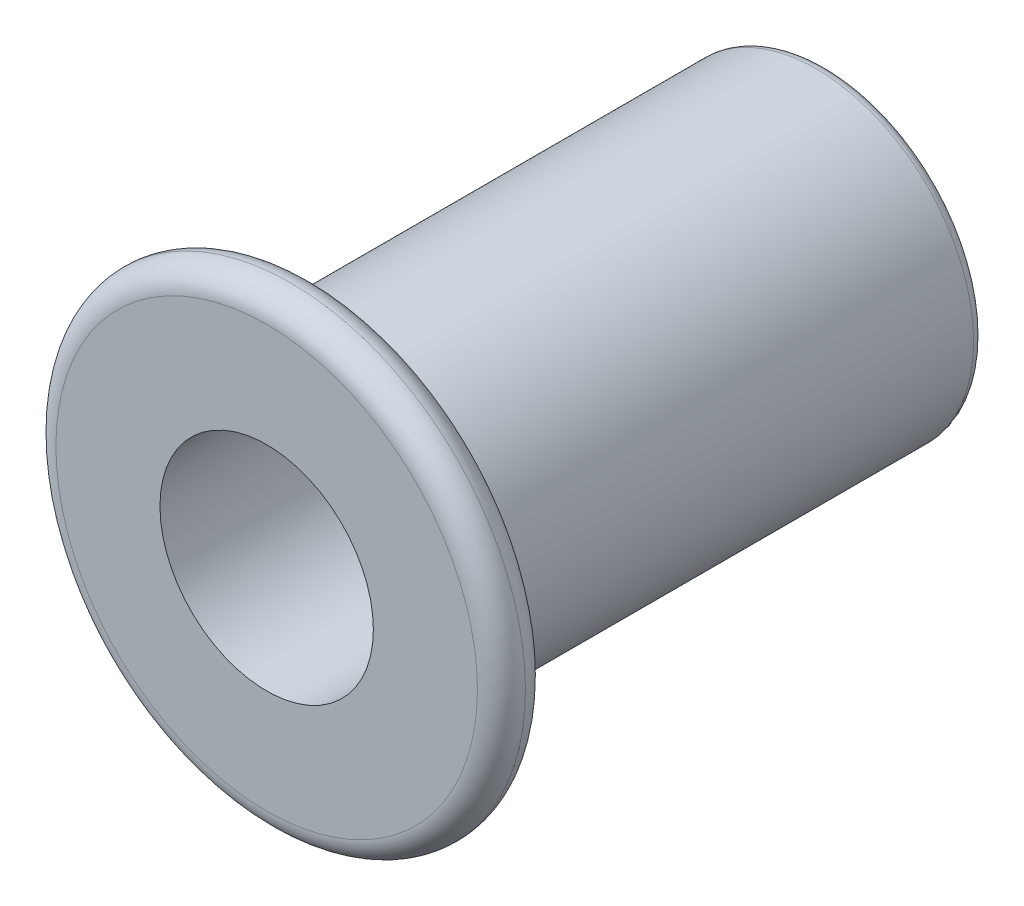
from build123d import *

# Parameters (mm, degrees)
SKETCH_1_R      = 2.95
SKETCH_1_R_2    = 2
EXTRUDE_1_DEPTH = 9.6
EXTRUDE_START   = 0.9
SKETCH_2_R      = 4.4
SKETCH_2_R_2    = 2
EXTRUDE_2_DEPTH = 0.9
FILLET_1_R      = 0.45
FILLET_2_R      = 0.2


with BuildPart() as part:
    # 草图1 → 凸台-拉伸1 (new body)
    with BuildSketch(Plane.XY):
        Circle(SKETCH_1_R)
        Circle(SKETCH_1_R_2, mode=Mode.SUBTRACT)
    extrude(amount=-EXTRUDE_1_DEPTH)

    # 草图2 → 凸台-拉伸2 (add)
    with BuildSketch(Plane.XY.offset(EXTRUDE_START)):
        Circle(SKETCH_2_R)
        Circle(SKETCH_2_R_2, mode=Mode.SUBTRACT)
    extrude(amount=-EXTRUDE_2_DEPTH)

    # 圆角1
    fillet_1_edges = [part.edges().sort_by_distance(p)[0] for p in [
        (-4.4, 0, 0),
        (-4.4, 0, 0.9),
    ]]
    fillet(fillet_1_edges, radius=FILLET_1_R - 0.0001)  # a hair under: the kernel refuses the full size

    # 圆角2
    fillet_2_edges = [part.edges().sort_by_distance(p)[0] for p in [
        (-2.95, 0, -9.6),
        (-2, 0, -9.6),
    ]]
    fillet(fillet_2_edges, radius=FILLET_2_R)


solid = part.part
